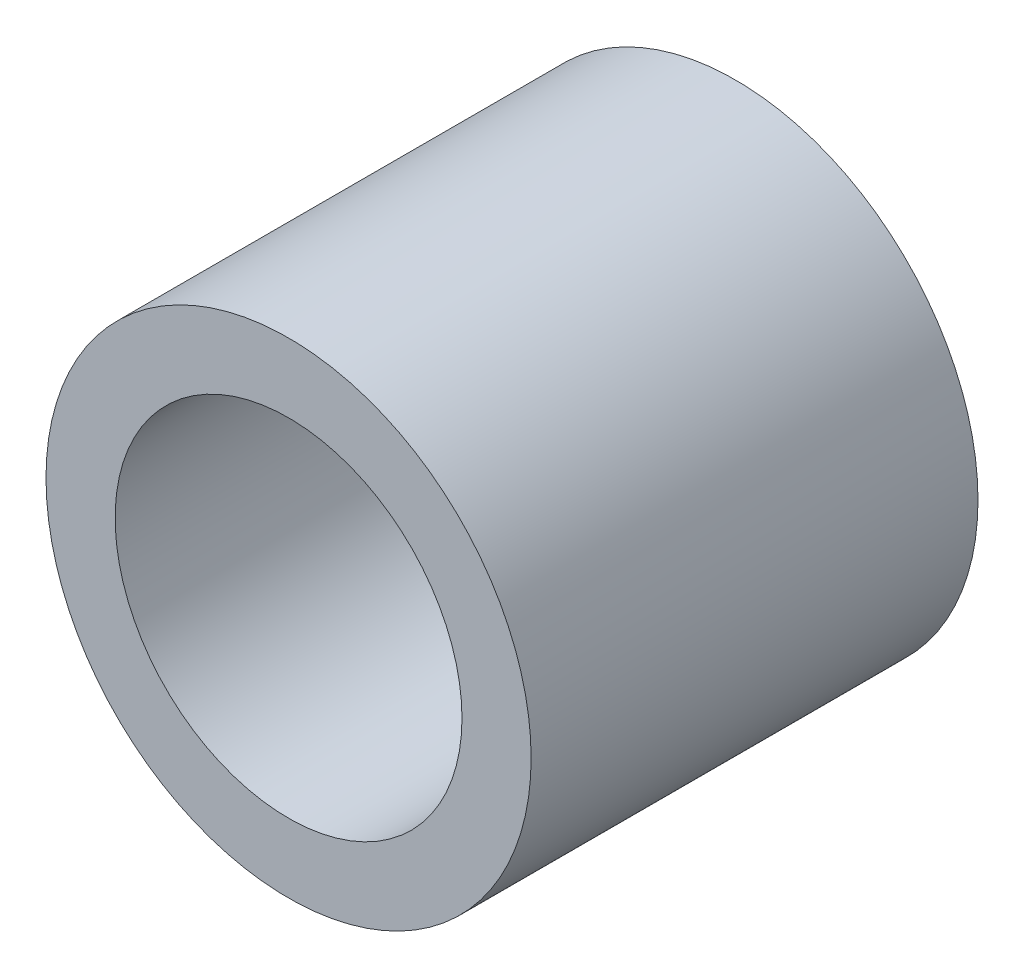
from build123d import *

# Parameters (mm, degrees)
SKETCH1_R           = 5.55625
SKETCH1_R_2         = 3.97256
BOSS_EXTRUDE1_DEPTH = 10.2362


with BuildPart() as part:
    # Sketch1 → Boss-Extrude1 (new body)
    with BuildSketch(Plane.XY):
        Circle(SKETCH1_R)
        Circle(SKETCH1_R_2, mode=Mode.SUBTRACT)
    extrude(amount=BOSS_EXTRUDE1_DEPTH)


solid = part.part
